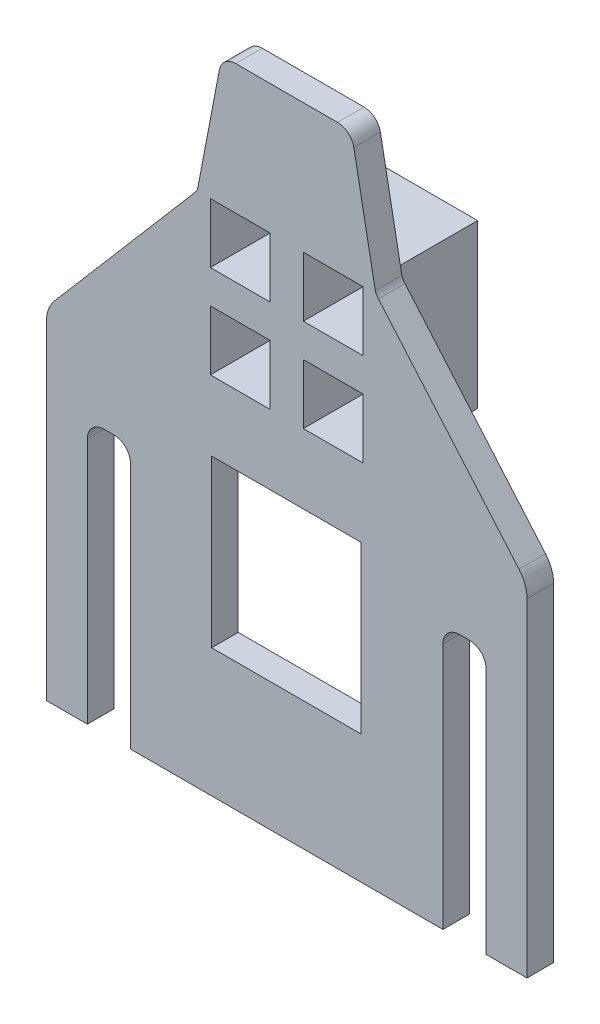
from build123d import *

# Parameters (mm, degrees)
BOSS_EXTRUDE1_DEPTH    = 8
SKETCH2_W              = 45
SKETCH2_H              = 50
CUT_EXTRUDE1_DEPTH     = 342.206659287
SPLIT1_SURFACE_1_BACK  = 343.199
SPLIT1_SURFACE_1_DEPTH = 686.398
SPLIT1_SURFACE_2_BACK  = 343.199
SPLIT1_SURFACE_2_DEPTH = 686.398
SKETCH5_R              = 2.5
CUT_EXTRUDE6_DEPTH     = 5.2
SKETCH4_R              = 2.5
CUT_EXTRUDE7_DEPTH     = 10
SKETCH6_R              = 1.5
CUT_EXTRUDE8_DEPTH     = 342.206659287
SKETCH7_W              = 49
SKETCH7_H              = 49
SKETCH7_W_2            = 18
SKETCH7_H_2            = 18
BOSS_EXTRUDE2_DEPTH    = 15
SKETCH8_W              = 49
SKETCH8_H              = 49
SKETCH8_R              = 1.5
BOSS_EXTRUDE3_DEPTH    = 10
SKETCH9_W              = 49
SKETCH9_H              = 49
CUT_EXTRUDE9_DEPTH     = 8
SKETCH10_W             = 18
SKETCH10_H             = 18
BOSS_EXTRUDE4_DEPTH    = 8


with BuildPart() as part:
    # Sketch1 → Boss-Extrude1 (new body)
    with BuildSketch(Plane.XY):
        with BuildLine():
            Line((70, 309.985818768), (85.299227191, 309.985818768))
            ThreePointArc((85.299227191, 309.985818768), (88.489017574, 308.836174247), (90.211957942, 305.915913694))
            Line((90.211957942, 305.915913694), (96.672728921, 271.790334282))
            ThreePointArc((96.672728921, 271.790334282), (97.06575438, 270.906904614), (97.621470019, 270.115641625))
            Line((97.621470019, 270.115641625), (139.950460317, 220.786053348))
            ThreePointArc((139.950460317, 220.786053348), (141.739336996, 217.746026552), (142.361429131, 214.274017901))
            Line((142.361429131, 214.274017901), (142.361429131, 30.859943174))
            ThreePointArc((142.361429131, 30.859943174), (140.896963037, 27.324409268), (137.361429131, 25.859943174))
            Line((137.361429131, 25.859943174), (114.717190871, 25.782318449))
            ThreePointArc((114.717190871, 25.782318449), (112.681998989, 25.341726514), (111.002773989, 24.110332733))
            Line((111.002773989, 24.110332733), (89.38285929, 0))
            Line((89.38285929, 0), (50.5, 0))
            Line((50.5, 0), (28.997226011, 24.110332733))
            ThreePointArc((28.997226011, 24.110332733), (27.318001011, 25.341726514), (25.282809129, 25.782318449))
            Line((25.282809129, 25.782318449), (2.638570869, 25.859943174))
            ThreePointArc((2.638570869, 25.859943174), (-0.896963037, 27.324409268), (-2.361429131, 30.859943174))
            Line((-2.361429131, 30.859943174), (-2.361429131, 214.274017901))
            ThreePointArc((-2.361429131, 214.274017901), (-1.739336996, 217.746026552), (0.049539683, 220.786053348))
            Line((0.049539683, 220.786053348), (42.261389271, 270.115641625))
            ThreePointArc((42.261389271, 270.115641625), (42.81710491, 270.906904614), (43.210130369, 271.790334282))
            Line((43.210130369, 271.790334282), (49.724618218, 305.923183314))
            ThreePointArc((49.724618218, 305.923183314), (51.449026762, 308.838533573), (54.635967087, 309.985818768))
            Line((54.635967087, 309.985818768), (70, 309.985818768))
        make_face()
        with BuildLine():
            Line((15.218798766, 54.807228462), (17.702103505, 54.807228462))
            ThreePointArc((17.702103505, 54.807228462), (21.420312934, 56.347361236), (22.960445707, 60.065570665))
            Line((22.960445707, 60.065570665), (22.960445707, 189.807228462))
            ThreePointArc((22.960445707, 189.807228462), (21.495979613, 193.342762368), (17.960445707, 194.807228462))
            Line((17.960445707, 194.807228462), (14.960456564, 194.807228462))
            ThreePointArc((14.960456564, 194.807228462), (11.424922658, 193.342762368), (9.960456564, 189.807228462))
            Line((9.960456564, 189.807228462), (9.960456564, 60.065570665))
            ThreePointArc((9.960456564, 60.065570665), (11.500589337, 56.347361236), (15.218798766, 54.807228462))
        make_face(mode=Mode.SUBTRACT)
        with BuildLine():
            Line((125.039543436, 54.807228462), (122.039554293, 54.807228462))
            ThreePointArc((122.039554293, 54.807228462), (118.504020387, 56.271694556), (117.039554293, 59.807228462))
            Line((117.039554293, 59.807228462), (117.039554293, 189.807228462))
            ThreePointArc((117.039554293, 189.807228462), (118.504020387, 193.342762368), (122.039554293, 194.807228462))
            Line((122.039554293, 194.807228462), (125.039543436, 194.807228462))
            ThreePointArc((125.039543436, 194.807228462), (128.575077342, 193.342762368), (130.039543436, 189.807228462))
            Line((130.039543436, 189.807228462), (130.039543436, 59.807228462))
            ThreePointArc((130.039543436, 59.807228462), (128.575077342, 56.271694556), (125.039543436, 54.807228462))
        make_face(mode=Mode.SUBTRACT)
    extrude(amount=BOSS_EXTRUDE1_DEPTH)

    # Sketch2 → Cut-Extrude1 (cut, through all)
    with BuildSketch(Plane.XY.offset(8)):
        with Locations((69.88285929, 179.008918923)):
            Rectangle(SKETCH2_W, SKETCH2_H)
    extrude(amount=-CUT_EXTRUDE1_DEPTH, mode=Mode.SUBTRACT)


with BuildPart() as body_2:
    # Split1: the piece behind the surface
    add(part.part)
    # Split1 surface: a surface, the sketch's curves swept straight by 686.398 mm
    with BuildLine(Plane(origin=(0, 0, 0), x_dir=(-1, 0, 0), z_dir=(0, 0, -1)).offset(-SPLIT1_SURFACE_1_BACK), mode=Mode.PRIVATE) as split1_surface_1_path:
        Line((-142.361429131, 115.359943174), (2.361429131, 115.359943174))
    split1_surface_1 = Shell.extrude(split1_surface_1_path.wire(), (0 * SPLIT1_SURFACE_1_DEPTH, 0 * SPLIT1_SURFACE_1_DEPTH, -1 * SPLIT1_SURFACE_1_DEPTH))
    split(bisect_by=split1_surface_1, keep=Keep.BOTTOM)

    # Sketch5 → Cut-Extrude6 (cut)
    with BuildSketch(Plane(origin=(0, 115.359943174, -115.359943174), x_dir=(1, 0, 0), z_dir=(0, -1, 0))):
        with Locations((70, 119.359943174)):
            Circle(SKETCH5_R)
        with Locations((40, 119.359943174)):
            Circle(SKETCH5_R)
        with Locations((2.638570869, 119.359943174)):
            Circle(SKETCH5_R)
    extrude(amount=CUT_EXTRUDE6_DEPTH, mode=Mode.SUBTRACT)


with BuildPart() as part_1:
    add(part.part)

    # Split1: split by a surface, the side it looks to stays
    # Split1 surface: a surface, the sketch's curves swept straight by 686.398 mm
    with BuildLine(Plane(origin=(0, 0, 0), x_dir=(-1, 0, 0), z_dir=(0, 0, -1)).offset(-SPLIT1_SURFACE_2_BACK), mode=Mode.PRIVATE) as split1_surface_2_path:
        Line((-142.361429131, 115.359943174), (2.361429131, 115.359943174))
    split1_surface_2 = Shell.extrude(split1_surface_2_path.wire(), (0 * SPLIT1_SURFACE_2_DEPTH, 0 * SPLIT1_SURFACE_2_DEPTH, -1 * SPLIT1_SURFACE_2_DEPTH))
    split(bisect_by=split1_surface_2, keep=Keep.TOP)

    # Sketch4 → Cut-Extrude7 (cut)
    with BuildSketch(Plane(origin=(0, 115.359943174, 0), x_dir=(-1, 0, 0), z_dir=(0, -1, 0))):
        with Locations((-70, -4)):
            Circle(SKETCH4_R)
        with Locations((-40, -4)):
            Circle(SKETCH4_R)
        with Locations((-100, -4)):
            Circle(SKETCH4_R)
        with Locations((-137.361429131, -4)):
            Circle(SKETCH4_R)
        with Locations((-3.799513716, -4)):
            Circle(SKETCH4_R)
    extrude(amount=-CUT_EXTRUDE7_DEPTH, mode=Mode.SUBTRACT)

    # Sketch6 → Cut-Extrude8 (cut, through all)
    with BuildSketch(Plane.XY.offset(8)):
        with Locations((50.000130369, 267.980334282)):
            Circle(SKETCH6_R)
        with Locations((90.000130369, 267.980334282)):
            Circle(SKETCH6_R)
        with Locations((90.000130369, 227.980334282)):
            Circle(SKETCH6_R)
        with Locations((50.000130369, 227.980334282)):
            Circle(SKETCH6_R)
    extrude(amount=-CUT_EXTRUDE8_DEPTH, mode=Mode.SUBTRACT)

    # Sketch7 → Boss-Extrude2 (add)
    with BuildSketch(Plane(origin=(0, 0, 0), x_dir=(-1, 0, 0), z_dir=(0, 0, -1))):
        with Locations((-70.000130369, 247.980334282)):
            Rectangle(SKETCH7_W, SKETCH7_H)
        with Locations((-56.000130369, 261.980334282)):
            Rectangle(SKETCH7_W_2, SKETCH7_H_2, mode=Mode.SUBTRACT)
        with Locations((-84.000130369, 261.980334282)):
            Rectangle(SKETCH7_W_2, SKETCH7_H_2, mode=Mode.SUBTRACT)
        with Locations((-84.000130369, 233.980334282)):
            Rectangle(SKETCH7_W_2, SKETCH7_H_2, mode=Mode.SUBTRACT)
        with Locations((-56.000130369, 233.980334282)):
            Rectangle(SKETCH7_W_2, SKETCH7_H_2, mode=Mode.SUBTRACT)
    extrude(amount=BOSS_EXTRUDE2_DEPTH)

    # Sketch8 → Boss-Extrude3 (add)
    with BuildSketch(Plane(origin=(0, 0, -15), x_dir=(-1, 0, 0), z_dir=(0, 0, -1))):
        with Locations((-70.000130369, 247.980334282)):
            Rectangle(SKETCH8_W, SKETCH8_H)
        with Locations((-50.000130369, 267.980334282)):
            Circle(SKETCH8_R, mode=Mode.SUBTRACT)
        with Locations((-90.000130369, 267.980334282)):
            Circle(SKETCH8_R, mode=Mode.SUBTRACT)
        with Locations((-50.000130369, 227.980334282)):
            Circle(SKETCH8_R, mode=Mode.SUBTRACT)
        with Locations((-90.000130369, 227.980334282)):
            Circle(SKETCH8_R, mode=Mode.SUBTRACT)
    extrude(amount=BOSS_EXTRUDE3_DEPTH)

    # Sketch9 → Cut-Extrude9 (cut)
    with BuildSketch(Plane.XY.offset(8)):
        with Locations((70.000130369, 247.980334282)):
            Rectangle(SKETCH9_W, SKETCH9_H)
    extrude(amount=-CUT_EXTRUDE9_DEPTH, mode=Mode.SUBTRACT)


with BuildPart() as cut_extrude9_piece_1:
    # of the separate pieces the step leaves, piece 1, a body of its own (cut_extrude9_pieces)
    add(part_1.part.solids().sort_by_distance((49.724618218, 305.923183314, 0))[0])



with BuildPart() as cut_extrude9_piece_2:
    # of the separate pieces the step leaves, piece 2, a body of its own (cut_extrude9_pieces)
    add(part_1.part.solids().sort_by_distance((45.500130369, 223.480334282, -25))[0])


with BuildPart() as cut_extrude9_piece_1_1:
    add(cut_extrude9_piece_1.part)

    add(cut_extrude9_piece_2.part)  # Boss-Extrude4 merges Cut-Extrude9 piece 2
    # Sketch10 → Boss-Extrude4 (add)
    with BuildSketch(Plane.XY):
        Polygon((45.500130369, 223.480334282), (94.500130369, 223.480334282), (94.500130369, 272.480334282), (45.500130369, 272.480334282), (45.500130369, 242.980334282), (45.500130369, 224.980334282), align=None)
        with Locations((56.000130369, 233.980334282)):
            Rectangle(SKETCH10_W, SKETCH10_H, mode=Mode.SUBTRACT)
        with Locations((84.000130369, 233.980334282)):
            Rectangle(SKETCH10_W, SKETCH10_H, mode=Mode.SUBTRACT)
        with Locations((56.000130369, 261.980334282)):
            Rectangle(SKETCH10_W, SKETCH10_H, mode=Mode.SUBTRACT)
        with Locations((84.000130369, 261.980334282)):
            Rectangle(SKETCH10_W, SKETCH10_H, mode=Mode.SUBTRACT)
    extrude(amount=BOSS_EXTRUDE4_DEPTH)


solid = cut_extrude9_piece_1_1.part
